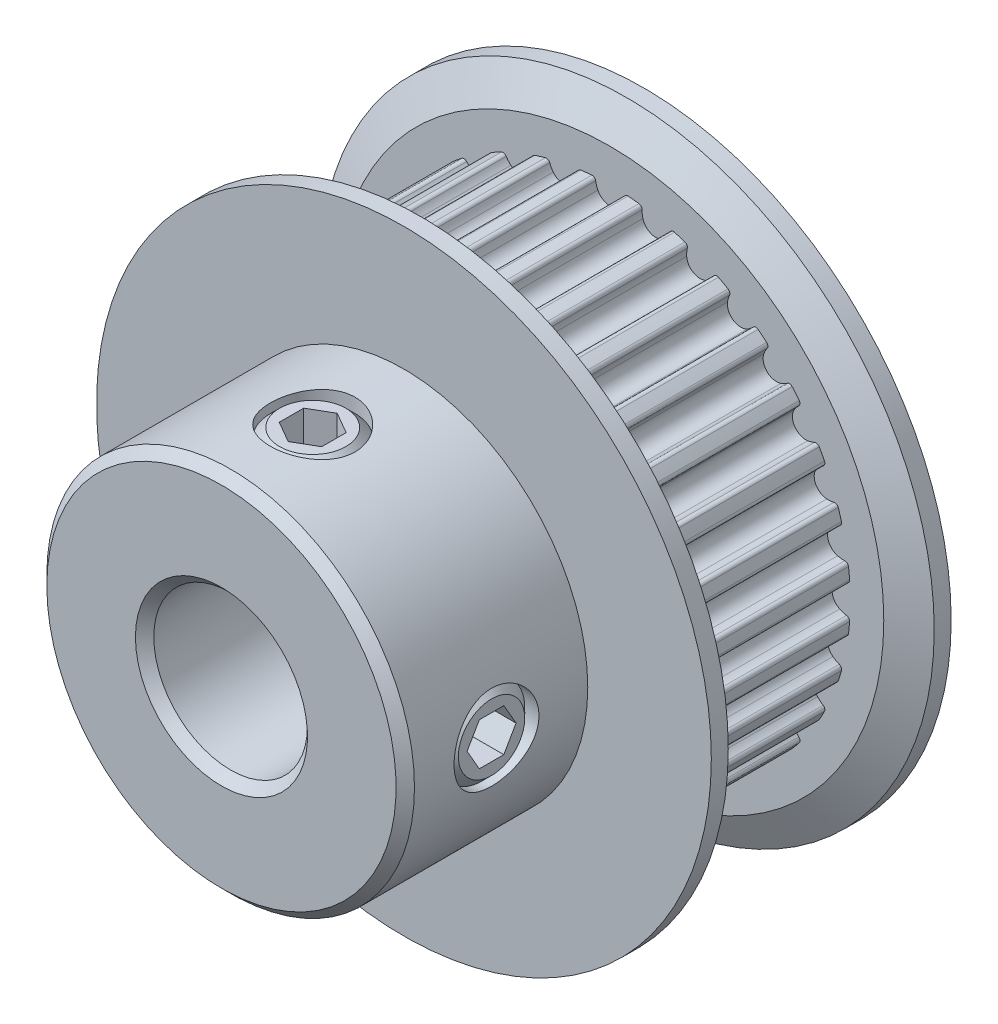
from build123d import *

# Parameters (mm, degrees)
CUT_EXTRUDE1_START = -0.2149
CUT_EXTRUDE1_DEPTH = 7.11
CIRPATTERN1_COUNT  = 32
SKETCH4_R          = 1.7526
CUT_EXTRUDE2_DEPTH = 20.967570709
CUT_EXTRUDE3_DEPTH = 1.31445
CIRPATTERN2_COUNT  = 2
CIRPATTERN2_ANGLE  = 90
CHAMFER1_SIZE      = 0.37975


with BuildPart() as part:
    # Sketch2 → Revolve1 (revolve)
    with BuildSketch(Plane(origin=(0, 0, 0), x_dir=(0, 0, -1), z_dir=(1, 0, 0)), mode=Mode.PRIVATE) as revolve1_sk:
        Polygon((-8.7249, 3.175), (8.7249, 3.175), (8.7249, 12.7), (8.0249, 12.7), (7.3249, 11.31575), (7.3249, 9.9315), (0.2149, 9.9315), (0.2149, 11.31575), (-0.4851, 12.7), (-1.1851, 12.7), (-1.1851, 7.595), (-8.7249, 7.595), align=None)
    revolve(revolve1_sk.sketch.rotate(Axis((0, 0, 8.7249), (0, 0, -1)), 90), axis=Axis((0, 0, 8.7249), (0, 0, -1)))

    # Sketch3 → Cut-Extrude1 (cut)
    with BuildSketch(Plane.XY.offset(CUT_EXTRUDE1_START)):
        with BuildLine():
            Line((2.530476216, 12.7), (-2.530476216, 12.7))
            Line((-2.530476216, 12.7), (-1.940703719, 9.740039082))
            ThreePointArc((-1.940703719, 9.740039082), (-1.346564619, 9.839789427), (-0.747470493, 9.903331768))
            ThreePointArc((-0.747470493, 9.903331768), (-0.643016659, 9.871317346), (-0.587983568, 9.776941049))
            ThreePointArc((-0.587983568, 9.776941049), (-0.554030146, 9.631789337), (-0.498876404, 9.493297753))
            ThreePointArc((-0.498876404, 9.493297753), (0, 9.1815), (0.498876404, 9.493297753))
            ThreePointArc((0.498876404, 9.493297753), (0.554030146, 9.631789337), (0.587983568, 9.776941049))
            ThreePointArc((0.587983568, 9.776941049), (0.643016659, 9.871317346), (0.747470493, 9.903331768))
            ThreePointArc((0.747470493, 9.903331768), (1.346564619, 9.839789427), (1.940703719, 9.740039082))
            Line((1.940703719, 9.740039082), (2.530476216, 12.7))
        make_face()
    cut_extrude1 = extrude(amount=-CUT_EXTRUDE1_DEPTH, mode=Mode.SUBTRACT)

    # CirPattern1: Cut-Extrude1 ×32 about axis
    cirpattern1_axis = Axis((0, 0, 0), (0, 0, 1))
    for i in range(1, CIRPATTERN1_COUNT):
        add(cut_extrude1.rotate(cirpattern1_axis, i * 360 / CIRPATTERN1_COUNT), mode=Mode.SUBTRACT)

    # Sketch4 → Cut-Extrude2 (cut, through all)
    with BuildSketch(Plane(origin=(0, 0, 0), x_dir=(0, -1, 0), z_dir=(1, 0, 0))):
        with Locations(Location((0, -4.955, 0), (0, 0, 270.000000003))):
            Circle(SKETCH4_R)
    cut_extrude2 = extrude(amount=CUT_EXTRUDE2_DEPTH, mode=Mode.SUBTRACT)

    # Sketch5 → Revolve2 (revolve)
    with BuildSketch(Plane.XY.offset(4.955), mode=Mode.PRIVATE) as revolve2_sk:
        Polygon((3.175, -1.3716), (3.175, 0), (7.390021532, 0), (7.390021532, -1.3716), (7.009021532, -1.7526), (3.556, -1.7526), align=None)
    revolve2 = revolve(revolve2_sk.sketch.rotate(Axis((3.175, 0, 4.955), (1, 0, 0)), 270), axis=Axis((3.175, 0, 4.955), (1, 0, 0)))

    # Sketch6 → Cut-Extrude3 (cut)
    with BuildSketch(Plane(origin=(7.390021532, 5.384140679, 0), x_dir=(0, -1, 0), z_dir=(-1, 0, 0))):
        Polygon((5.384140679, 5.966864082), (4.507840679, 5.460932041), (4.507840679, 4.449067959), (5.384140679, 3.943135918), (6.260440679, 4.449067959), (6.260440679, 5.460932041), align=None)
    cut_extrude3 = extrude(amount=CUT_EXTRUDE3_DEPTH, mode=Mode.SUBTRACT)

    # CirPattern2: Cut-Extrude2, Revolve2, Cut-Extrude3 ×2 about axis
    cirpattern2_axis = Axis((0, 0, 0), (0, 0, 1))
    add([cut_extrude2.rotate(cirpattern2_axis, i * CIRPATTERN2_ANGLE / (CIRPATTERN2_COUNT - 1)) for i in range(1, CIRPATTERN2_COUNT)], mode=Mode.SUBTRACT)
    add([revolve2.rotate(cirpattern2_axis, i * CIRPATTERN2_ANGLE / (CIRPATTERN2_COUNT - 1)) for i in range(1, CIRPATTERN2_COUNT)])
    add([cut_extrude3.rotate(cirpattern2_axis, i * CIRPATTERN2_ANGLE / (CIRPATTERN2_COUNT - 1)) for i in range(1, CIRPATTERN2_COUNT)], mode=Mode.SUBTRACT)

    # Chamfer1
    chamfer1_edges = [part.edges().sort_by_distance(p)[0] for p in [
        (-7.595, 0, 8.7249),
        (-3.175, 0, 8.7249),
    ]]
    chamfer(chamfer1_edges, length=CHAMFER1_SIZE)


solid = part.part
